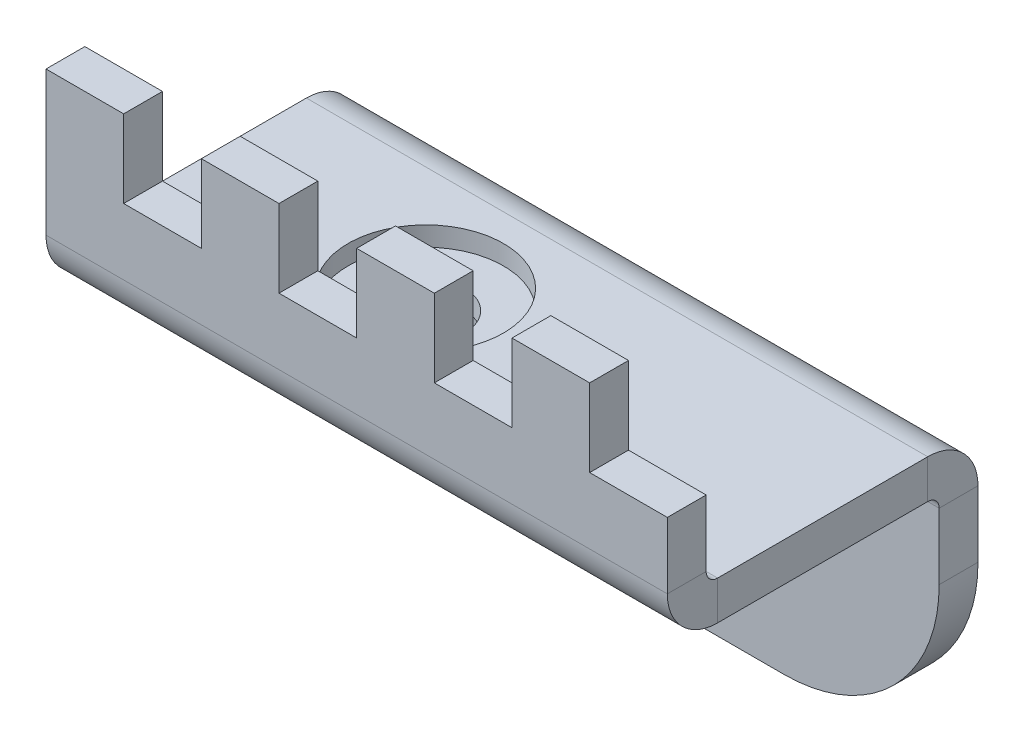
from build123d import *

# Parameters (mm, degrees)
SKETCH1_W           = 40
SKETCH1_H           = 50
SKETCH1_R           = 1.25
BASE_FLANGE1_DEPTH  = 2.5
SKETCH15_R          = 1
CUT_EXTRUDE3_DEPTH  = 10
JOG3_START          = -2.5
JOG3_OUTLINE_W      = 40
JOG3_OUTLINE_H      = 48.294687966
JOG3_OUTLINE_R      = 1
JOG3_OUTLINE_R_2    = 1.25
JOG3_DEPTH          = 2.5
JOG3_2_OUTLINE_W    = 40
JOG3_2_OUTLINE_H    = 1.705312034
JOG3_2_DEPTH        = 0.332528284
JOG3_START_2        = 14.2634
JOG3_3_OUTLINE_W    = 40
JOG3_3_OUTLINE_H    = 35
JOG3_3_OUTLINE_R    = 1
JOG3_3_OUTLINE_R_2  = 1.25
JOG3_3_DEPTH        = 3.2366
JOG3_4_OUTLINE_W    = 40
JOG3_4_OUTLINE_H    = 15.794687966
JOG3_4_OUTLINE_R    = 1.25
JOG3_4_DEPTH        = 3.2366
JOG3_5_OUTLINE_W    = 40
JOG3_5_OUTLINE_H    = 2.5
JOG3_5_DEPTH        = 15
JOG3_START_3        = 15
JOG3_6_OUTLINE_R    = 1.25
JOG3_6_OUTLINE_R_2  = 1
JOG3_6_DEPTH        = 2.5
JOG3_START_4        = -20
JOG3_7_DEPTH        = 40
JOG4_START          = -20
JOG4_DEPTH          = 40
JOG4_2_DEPTH        = 40
JOG4_START_2        = -3
JOG4_3_OUTLINE_R    = 1.25
JOG4_3_DEPTH        = 4
FILLET1_R           = 10
SKETCH18_R          = 2.5
BOSS_EXTRUDE1_DEPTH = 2.5
SKETCH19_R          = 1
SKETCH19_W          = 23.5
SKETCH19_H          = 12.5
CUT_EXTRUDE4_DEPTH  = 2.5
SKETCH20_R          = 2.5
SKETCH20_R_2        = 1.25
CUT_EXTRUDE6_DEPTH  = 10
SKETCH23_R          = 2.5
CUT_EXTRUDE7_DEPTH  = 44.945989578
SKETCH24_R          = 5
CUT_EXTRUDE8_DEPTH  = 1.25
SKETCH25_W          = 40
SKETCH25_H          = 18.401872862
CUT_EXTRUDE9_DEPTH  = 50.640775238


with BuildPart() as part:
    # Base-Flange1: sheet metal written as solids
    # Sketch1 → Base-Flange1 (new body)
    with BuildSketch(Plane.XY):
        Rectangle(SKETCH1_W, SKETCH1_H)
        with Locations((10, 12.5)):
            Circle(SKETCH1_R, mode=Mode.SUBTRACT)
        with Locations(Location((10, -12.5, 0), (0, 0, 180))):
            Circle(SKETCH1_R, mode=Mode.SUBTRACT)
        with Locations((-10, -12.5)):
            Circle(SKETCH1_R, mode=Mode.SUBTRACT)
        with Locations(Location((-10, 12.5, 0), (0, 0, 180))):
            Circle(SKETCH1_R, mode=Mode.SUBTRACT)
    extrude(amount=-BASE_FLANGE1_DEPTH)

    # Sketch15 → Cut-Extrude3 (cut)
    with BuildSketch(Plane.XY):
        with Locations((12, 0)):
            Circle(SKETCH15_R)
        with Locations(Location((-17, 0, 0), (0, 0, 180))):
            Circle(SKETCH15_R)
    extrude(amount=-CUT_EXTRUDE3_DEPTH, mode=Mode.SUBTRACT)

    # Jog3: read off the stored shape, not the designer's step
    # Jog3 outline → Jog3 (cut)
    with BuildSketch(Plane.XY.offset(JOG3_START)):
        with Locations((0, -0.852656017)):
            Rectangle(JOG3_OUTLINE_W, JOG3_OUTLINE_H)
        with Locations((-17, 0)):
            Circle(JOG3_OUTLINE_R, mode=Mode.SUBTRACT)
        with Locations((12, 0)):
            Circle(JOG3_OUTLINE_R, mode=Mode.SUBTRACT)
        with Locations((-10, 12.5)):
            Circle(JOG3_OUTLINE_R_2, mode=Mode.SUBTRACT)
        with Locations((10, 12.5)):
            Circle(JOG3_OUTLINE_R_2, mode=Mode.SUBTRACT)
        with Locations((10, -12.5)):
            Circle(JOG3_OUTLINE_R_2, mode=Mode.SUBTRACT)
        with Locations((-10, -12.5)):
            Circle(JOG3_OUTLINE_R_2, mode=Mode.SUBTRACT)
    extrude(amount=JOG3_DEPTH, mode=Mode.SUBTRACT)

    # Jog3 2 outline → Jog3 2 (cut)
    with BuildSketch(Plane.XY.offset(JOG3_START)):
        with Locations((0, 24.147343983)):
            Rectangle(JOG3_2_OUTLINE_W, JOG3_2_OUTLINE_H)
    extrude(amount=JOG3_2_DEPTH, mode=Mode.SUBTRACT)

    # Jog3 4 outline → Jog3 4 (add)
    with BuildSketch(Plane.XY.offset(JOG3_START)):
        with Locations((0, 32.897343983)):
            Rectangle(JOG3_4_OUTLINE_W, JOG3_4_OUTLINE_H)
        with Locations((10, 28.294687966)):
            Circle(JOG3_4_OUTLINE_R, mode=Mode.SUBTRACT)
        with Locations((-10, 28.294687966)):
            Circle(JOG3_4_OUTLINE_R, mode=Mode.SUBTRACT)
    extrude(amount=JOG3_4_DEPTH)



with BuildPart() as body_2:
    # Jog3 3 outline → Jog3 3 (new body)
    with BuildSketch(Plane.XY.offset(JOG3_START_2)):
        with Locations((0, 8.294687966)):
            Rectangle(JOG3_3_OUTLINE_W, JOG3_3_OUTLINE_H)
        with Locations((12, 15.794687966)):
            Circle(JOG3_3_OUTLINE_R, mode=Mode.SUBTRACT)
        with Locations((-17, 0)):
            Circle(JOG3_3_OUTLINE_R, mode=Mode.SUBTRACT)
        with Locations((-10, 3.294687966)):
            Circle(JOG3_3_OUTLINE_R_2, mode=Mode.SUBTRACT)
        with Locations((12, 0)):
            Circle(JOG3_3_OUTLINE_R, mode=Mode.SUBTRACT)
        with Locations((10, 3.294687966)):
            Circle(JOG3_3_OUTLINE_R_2, mode=Mode.SUBTRACT)
        with Locations((-17, 15.794687966)):
            Circle(JOG3_3_OUTLINE_R, mode=Mode.SUBTRACT)
        with Locations((-10, 12.5)):
            Circle(JOG3_3_OUTLINE_R_2, mode=Mode.SUBTRACT)
        with Locations((10, 12.5)):
            Circle(JOG3_3_OUTLINE_R_2, mode=Mode.SUBTRACT)
    extrude(amount=JOG3_3_DEPTH)


with BuildPart() as part_1:
    add(part.part)

    add(body_2.part)  # Jog3 5 merges body 2
    # Jog3 5 outline → Jog3 5 (add)
    with BuildSketch(Plane.XY):
        with Locations((0, 24.544687966)):
            Rectangle(JOG3_5_OUTLINE_W, JOG3_5_OUTLINE_H)
    extrude(amount=JOG3_5_DEPTH)

    # Jog3 6 outline → Jog3 6 (add)
    with BuildSketch(Plane.XY.offset(JOG3_START_3)):
        with Locations((10, 12.5)):
            Circle(JOG3_6_OUTLINE_R)
        with Locations((-10, 12.5)):
            Circle(JOG3_6_OUTLINE_R)
        with Locations((12, 0)):
            Circle(JOG3_6_OUTLINE_R_2)
        with Locations((-17, 0)):
            Circle(JOG3_6_OUTLINE_R_2)
    extrude(amount=JOG3_6_DEPTH)

    # Jog3 7 outline → Jog3 7 (cut)
    with BuildSketch(Plane.YZ.offset(JOG3_START_4)):
        with BuildLine():
            ThreePointArc((23.294687966, 14.2634), (23.078942821, 14.784254855), (22.558087966, 15))
            Line((22.558087966, 15), (-9.205312034, 15))
            Line((-9.205312034, 15), (-9.205312034, 14.2634))
            Line((-9.205312034, 14.2634), (23.294687966, 14.2634))
        make_face()
        with BuildLine():
            ThreePointArc((26.531287966, -2.5), (24.242666158, -1.552021808), (23.294687966, 0.7366))
            Line((23.294687966, 0.7366), (23.294687966, -2.167471716))
            Line((23.294687966, -2.167471716), (25, -2.167471716))
            Line((25, -2.167471716), (25, -2.5))
            Line((25, -2.5), (26.531287966, -2.5))
        make_face()
        with BuildLine():
            Line((26.531287966, 0), (40.794687966, 0))
            Line((40.794687966, 0), (40.794687966, 0.7366))
            Line((40.794687966, 0.7366), (25.794687966, 0.7366))
            ThreePointArc((25.794687966, 0.7366), (26.010433111, 0.215745145), (26.531287966, 0))
        make_face()
        with BuildLine():
            Line((25.794687966, 17.5), (22.558087966, 17.5))
            ThreePointArc((22.558087966, 17.5), (24.846709774, 16.552021808), (25.794687966, 14.2634))
            Line((25.794687966, 14.2634), (25.794687966, 17.5))
        make_face()
    extrude(amount=JOG3_7_DEPTH, mode=Mode.SUBTRACT)

    # Jog4: read off the stored shape, not the designer's step
    # Jog4 outline → Jog4 (cut)
    with BuildSketch(Plane.YZ.offset(JOG4_START)):
        with BuildLine():
            Line((-9.205312034, 15), (5.87962174, 15))
            ThreePointArc((5.87962174, 15), (7.019882984, 16.799110859), (9.031287966, 17.5))
            Line((9.031287966, 17.5), (-9.205312034, 17.5))
            Line((-9.205312034, 17.5), (-9.205312034, 15))
        make_face()
    extrude(amount=JOG4_DEPTH, mode=Mode.SUBTRACT)

    # Jog4 2 outline → Jog4 2 (add)
    with BuildSketch(Plane.YZ.offset(JOG4_START)):
        with BuildLine():
            Line((-9.205312034, 0), (-9.205312034, -2.5))
            Line((-9.205312034, -2.5), (5.058087966, -2.5))
            ThreePointArc((5.058087966, -2.5), (7.346709774, -1.552021808), (8.294687966, 0.7366))
            Line((8.294687966, 0.7366), (8.294687966, 14.2634))
            ThreePointArc((8.294687966, 14.2634), (8.510433111, 14.784254855), (9.031287966, 15))
            Line((9.031287966, 15), (5.87962174, 15))
            ThreePointArc((5.87962174, 15), (5.81599152, 14.634140241), (5.794687966, 14.2634))
            Line((5.794687966, 14.2634), (5.794687966, 0.7366))
            ThreePointArc((5.794687966, 0.7366), (5.578942821, 0.215745145), (5.058087966, 0))
            Line((5.058087966, 0), (-9.205312034, 0))
        make_face()
    extrude(amount=JOG4_2_DEPTH)

    # Jog4 3 outline → Jog4 3 (cut)
    with BuildSketch(Plane.XY.offset(JOG4_START_2)):
        with Locations((-10, 3.294687966)):
            Circle(JOG4_3_OUTLINE_R)
        with Locations((10, 3.294687966)):
            Circle(JOG4_3_OUTLINE_R)
    extrude(amount=JOG4_3_DEPTH, mode=Mode.SUBTRACT)

    # Fillet1
    fillet1_edges = [part_1.edges().sort_by_distance(p)[0] for p in [
        (20, -9.205312034, -1.25),
        (-20, -9.205312034, -1.25),
        (-20, 40.794687966, -1.25),
        (20, 40.794687966, -1.25),
    ]]
    fillet(fillet1_edges, radius=FILLET1_R)

    # Sketch18 → Boss-Extrude1 (add)
    with BuildSketch(Plane.XY.offset(17.5)):
        with Locations((12, 15.794687966)):
            Circle(SKETCH18_R)
        with Locations((-17, 15.794687966)):
            Circle(SKETCH18_R)
    extrude(amount=-BOSS_EXTRUDE1_DEPTH)

    # Sketch19 → Cut-Extrude4 (cut)
    with BuildSketch(Plane(origin=(0, 25.794687966, 0), x_dir=(1, 0, 0), z_dir=(0, 1, 0))):
        with Locations(Location((13.9, -7.5, 0), (0, 0, 270))):
            Circle(SKETCH19_R)
        with Locations(Location((-13.9, -7.5, 0), (0, 0, 90))):
            Circle(SKETCH19_R)
        with Locations((0, -7.5)):
            Rectangle(SKETCH19_W, SKETCH19_H)
    extrude(amount=-CUT_EXTRUDE4_DEPTH, mode=Mode.SUBTRACT)

    # Sketch20 → Cut-Extrude6 (cut)
    with BuildSketch(Plane.XY):
        with Locations((0, 33.294687966)):
            Circle(SKETCH20_R)
        with Locations(Location((0, -1.705312034, 0), (0, 0, 180))):
            Circle(SKETCH20_R)
        with Locations((7.5, -1.705312034)):
            Circle(SKETCH20_R_2)
        with Locations(Location((-7.5, -1.705312034, 0), (0, 0, 180))):
            Circle(SKETCH20_R_2)
        with Locations(Location((7.5, 33.294687966, 0), (0, 0, 180))):
            Circle(SKETCH20_R_2)
        with Locations((-7.5, 33.294687966)):
            Circle(SKETCH20_R_2)
    extrude(amount=-CUT_EXTRUDE6_DEPTH, mode=Mode.SUBTRACT)

    # Sketch23 → Cut-Extrude7 (cut, through all)
    with BuildSketch(Plane(origin=(0, 25.794687966, 0), x_dir=(1, 0, 0), z_dir=(0, 1, 0))):
        with Locations(Location((-5.55, -7.5, 0), (0, 0, 270))):
            Circle(SKETCH23_R)
    extrude(amount=-CUT_EXTRUDE7_DEPTH, mode=Mode.SUBTRACT)

    # Sketch24 → Cut-Extrude8 (cut)
    with BuildSketch(Plane(origin=(0, 8.294687966, 0), x_dir=(1, 0, 0), z_dir=(0, 1, 0))):
        with Locations(Location((-5.55, -7.5, 0), (0, 0, 270))):
            Circle(SKETCH24_R)
    extrude(amount=-CUT_EXTRUDE8_DEPTH, mode=Mode.SUBTRACT)

    # Sketch25 → Cut-Extrude9 (cut, through all)
    with BuildSketch(Plane.XY.offset(17.5)):
        Polygon((-20, 22.558087966), (-20, 18.294687966), (-15, 18.294687966), (-15, 13.294687966), (-10, 13.294687966), (-10, 15.794687966), (-10, 18.294687966), (-5, 18.294687966), (-5, 13.294687966), (0, 13.294687966), (0, 15.794687966), (0, 18.294687966), (5, 18.294687966), (5, 13.294687966), (10, 13.294687966), (10, 15.794687966), (10, 18.294687966), (15, 18.294687966), (15, 13.294687966), (20, 13.294687966), (20, 15.794687966), (20, 22.558087966), align=None)
        with Locations((0, 31.759024397)):
            Rectangle(SKETCH25_W, SKETCH25_H)
    extrude(amount=-CUT_EXTRUDE9_DEPTH, mode=Mode.SUBTRACT)


solid = part_1.part
